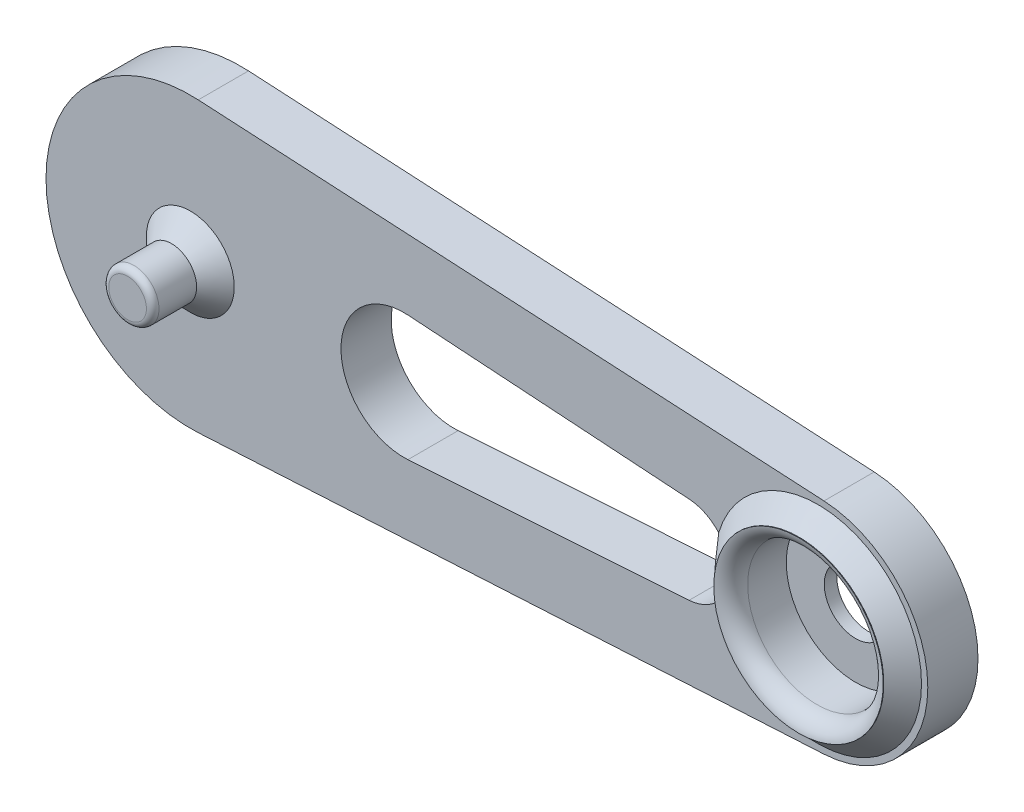
from build123d import *

# Parameters (mm, degrees)
SKETCH5_R           = 4
BOSS_EXTRUDE1_DEPTH = 10
SKETCH13_R          = 5.0000000000000036
BOSS_EXTRUDE5_DEPTH = 8
CHAMFER1_SIZE       = 3
FILLET1_R           = 1
SKETCH14_R          = 13.499999999999998
BOSS_EXTRUDE6_DEPTH = 3.1
CUT_EXTRUDE1_START  = -6
SKETCH15_R          = 11.050000000000002
CUT_EXTRUDE1_DEPTH  = 20
FILLET2_R           = 3
CHAMFER2_SIZE       = 3


with BuildPart() as part:
    # Sketch5 → Boss-Extrude1 (new body)
    with BuildSketch(Plane(origin=(0, 0, 0), x_dir=(0, 1, 0), z_dir=(0, 0, 1))):
        with Locations(Location((0, 0, 0), (0, 0, 270))):
            Circle(SKETCH5_R)
    extrude(amount=BOSS_EXTRUDE1_DEPTH)

    # Sketch13 → Boss-Extrude5 (add)
    with BuildSketch(Plane(origin=(0, 0, 0), x_dir=(0, 1, 0), z_dir=(0, 0, 1))):
        with BuildLine():
            Line((-17.473511202674743, -100.9625), (-22.96518615208682, -1.2650000000000037))
            ThreePointArc((-22.96518615208682, -1.2650000000000037), (1.41e-15, 23.000000000000004), (22.96518615208682, -1.2649999999999981))
            Line((22.96518615208682, -1.2649999999999981), (17.47351120267477, -100.9625))
            ThreePointArc((17.47351120267477, -100.9625), (1.332e-14, -117.5), (-17.473511202674743, -100.9625))
        make_face()
        with Locations(Location((1.225e-14, -100, 0), (0, 0, 270))):
            Circle(SKETCH13_R, mode=Mode.SUBTRACT)
        with BuildLine():
            Line((-9.977753031397176, -34.66666666666667), (-6.984427121978019, -79.46666666666665))
            ThreePointArc((-6.984427121978019, -79.46666666666665), (8.55e-15, -86), (6.9844271219780385, -79.46666666666665))
            Line((6.9844271219780385, -79.46666666666665), (9.977753031397182, -34.66666666666667))
            ThreePointArc((9.977753031397182, -34.66666666666667), (4.78e-15, -24), (-9.977753031397176, -34.66666666666667))
        make_face(mode=Mode.SUBTRACT)
    extrude(amount=-BOSS_EXTRUDE5_DEPTH)

    # Chamfer1
    chamfer1_edges = [part.edges().sort_by_distance(p)[0] for p in [
        (-4, 1.22e-15, 0),
    ]]
    chamfer(chamfer1_edges, length=CHAMFER1_SIZE)

    # Fillet1
    fillet1_edges = [part.edges().sort_by_distance(p)[0] for p in [
        (-4, 1.22e-15, 10),
    ]]
    fillet(fillet1_edges, radius=FILLET1_R)

    # Sketch14 → Boss-Extrude6 (add)
    with BuildSketch(Plane(origin=(0, 0, 0), x_dir=(0, 1, 0), z_dir=(0, 0, 1))):
        with Locations(Location((1.225e-14, -100, 0), (0, 0, 90))):
            Circle(SKETCH14_R)
    extrude(amount=BOSS_EXTRUDE6_DEPTH)

    # Sketch15 → Cut-Extrude1 (cut)
    with BuildSketch(Plane(origin=(0, 0, 0), x_dir=(0, 1, 0), z_dir=(0, 0, 1)).offset(CUT_EXTRUDE1_START)):
        with Locations(Location((1.225e-14, -100, 0), (0, 0, 270))):
            Circle(SKETCH15_R)
    extrude(amount=CUT_EXTRUDE1_DEPTH, mode=Mode.SUBTRACT)

    # Fillet2
    # the kernel refuses this fillet: 3 mm, written as the material it takes off along each edge
    with BuildSketch(Plane(origin=(100, 1.225e-14, 3.0999999999999996), x_dir=(1, -1.8e-16, 0), z_dir=(1.8e-16, 1, 0))) as fillet2_piece_1:
        with BuildLine():
            CenterArc((14.049999999999997, 2.949152420612873), FILLET2_R, 180, 79.43602241094561)
            Line((11.049999999999997, 2.949152420612873), (10.989999999999995, 2.949152420612873))
            Line((10.989999999999995, 2.949152420612873), (10.989999999999995, 0))
            Line((10.989999999999995, 0), (11.049999999999997, -0.06000000000000005))
            ThreePointArc((11.049999999999997, -0.06000000000000005), (12.275000000000105, -0.0600000000000005), (13.489000000000217, -0.05898304841112623))
            Line((13.489000000000217, -0.05898304841112623), (13.500000000000213, 1.10889e-12))
        make_face()
    revolve(axis=Axis((100, 1.225e-14, 3.0999999999999996), (0, 0, -1)), mode=Mode.SUBTRACT)

    # Chamfer2
    # the kernel refuses this chamfer: 3 mm, written as the material it adds along each edge
    with BuildSketch(Plane(origin=(100, 1.225e-14, 0), x_dir=(-1, 6e-17, 0), z_dir=(6e-17, 1, 0))) as chamfer2_piece_1_section:
        Polygon((13.5 + CHAMFER2_SIZE, 0), (13.5, CHAMFER2_SIZE), (13.5, 0), align=None)
    chamfer2_piece_1 = revolve(axis=Axis((100, 1.225e-14, 0), (0, 0, 1)), mode=Mode.PRIVATE)
    chamfer2_piece_1 = chamfer2_piece_1 - Plane(origin=(78.99999999999999, 9.77e-15, 1.4464911380903063), x_dir=(0.0666666666666669, -0.9977753031397177, 0), z_dir=(0, 0, 1)) * Cylinder(7.000000000000007, 66, mode=Mode.PRIVATE)
    add(chamfer2_piece_1)


solid = part.part
